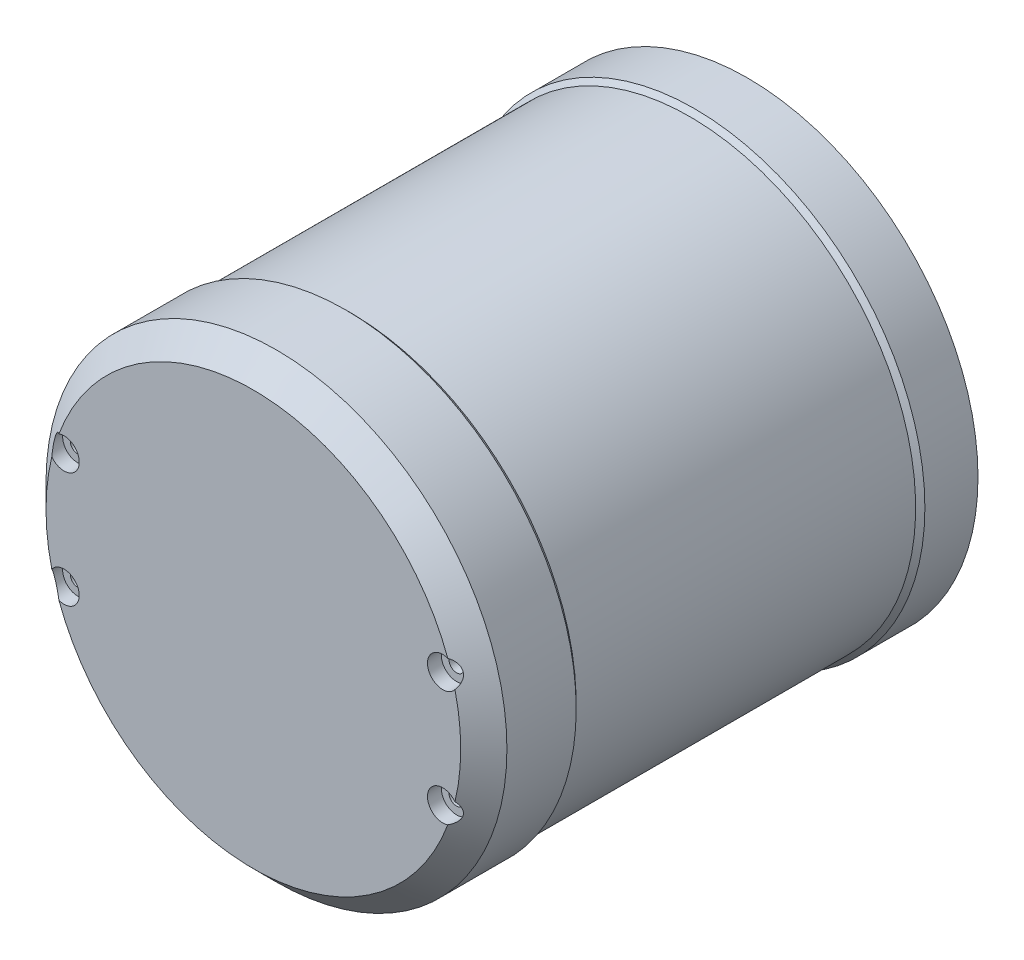
from build123d import *

# Parameters (mm, degrees)
SKETCH1_R           = 49.9
SKETCH1_R_2         = 47.5
BOSS_EXTRUDE1_DEPTH = 100
BOSS_EXTRUDE2_START = 7
SKETCH2_R           = 49.9
SKETCH2_R_2         = 1.65
BOSS_EXTRUDE2_DEPTH = 7
SKETCH3_R           = 3.3
CUT_EXTRUDE1_DEPTH  = 3
CHAMFER1_SIZE       = 5
SKETCH5_R           = 3.3
CUT_EXTRUDE2_DEPTH  = 8


with BuildPart() as part:
    # Sketch1 → Boss-Extrude1 (new body)
    with BuildSketch(Plane.XY):
        with Locations((0, 55)):
            Circle(SKETCH1_R)
        with Locations((0, 55)):
            Circle(SKETCH1_R_2, mode=Mode.SUBTRACT)
    extrude(amount=-BOSS_EXTRUDE1_DEPTH)

    # Sketch2 → Boss-Extrude2 (add)
    with BuildSketch(Plane.XY.offset(BOSS_EXTRUDE2_START)):
        with Locations((0, 55)):
            Circle(SKETCH2_R)
        with Locations((41, 67.5)):
            Circle(SKETCH2_R_2, mode=Mode.SUBTRACT)
        with Locations((41, 42.5)):
            Circle(SKETCH2_R_2, mode=Mode.SUBTRACT)
        with Locations((-41, 67.5)):
            Circle(SKETCH2_R_2, mode=Mode.SUBTRACT)
        with Locations((-41, 42.5)):
            Circle(SKETCH2_R_2, mode=Mode.SUBTRACT)
    extrude(amount=-BOSS_EXTRUDE2_DEPTH)

    # Sketch3 → Cut-Extrude1 (cut)
    with BuildSketch(Plane.XY.offset(7)):
        with Locations((-41, 67.5)):
            Circle(SKETCH3_R)
        with Locations((-41, 42.5)):
            Circle(SKETCH3_R)
        with Locations((41, 67.5)):
            Circle(SKETCH3_R)
        with Locations((41, 42.5)):
            Circle(SKETCH3_R)
    extrude(amount=-CUT_EXTRUDE1_DEPTH, mode=Mode.SUBTRACT)

    # Chamfer1
    # the kernel refuses this chamfer: 5 mm, written as the material it takes off along each edge
    with BuildSketch(Plane(origin=(0, 55, 7), x_dir=(1, 0, 0), z_dir=(0, -1, 0))) as chamfer1_piece_1:
        Polygon((49.9, -CHAMFER1_SIZE), (49.9 - CHAMFER1_SIZE, 0), (49.9, 0), align=None)
    revolve(axis=Axis((0, 55, 7), (0, 0, 1)), mode=Mode.SUBTRACT)

    # Sketch4 → Cut-Revolve1 (revolve, cut)
    with BuildSketch(Plane(origin=(0, 0, 0), x_dir=(0, 0, -1), z_dir=(1, 0, 0)), mode=Mode.PRIVATE) as cut_revolve1_sk:
        Polygon((13, 104.9), (14, 103.9), (87.5, 103.9), (88.5, 104.9), align=None)
    revolve(cut_revolve1_sk.sketch.rotate(Axis((0, 55, 2), (0, 0, 1)), 76.43618314), axis=Axis((0, 55, 2), (0, 0, 1)), mode=Mode.SUBTRACT)

    # Sketch5 → Cut-Extrude2 (cut)
    with BuildSketch(Plane(origin=(0, 0, -100), x_dir=(-1, 0, 0), z_dir=(0, 0, -1))):
        with Locations((-44, 45)):
            Circle(SKETCH5_R)
        with Locations((-44, 65)):
            Circle(SKETCH5_R)
        with Locations((44, 45)):
            Circle(SKETCH5_R)
        with Locations((44, 65)):
            Circle(SKETCH5_R)
    extrude(amount=-CUT_EXTRUDE2_DEPTH, mode=Mode.SUBTRACT)


solid = part.part
